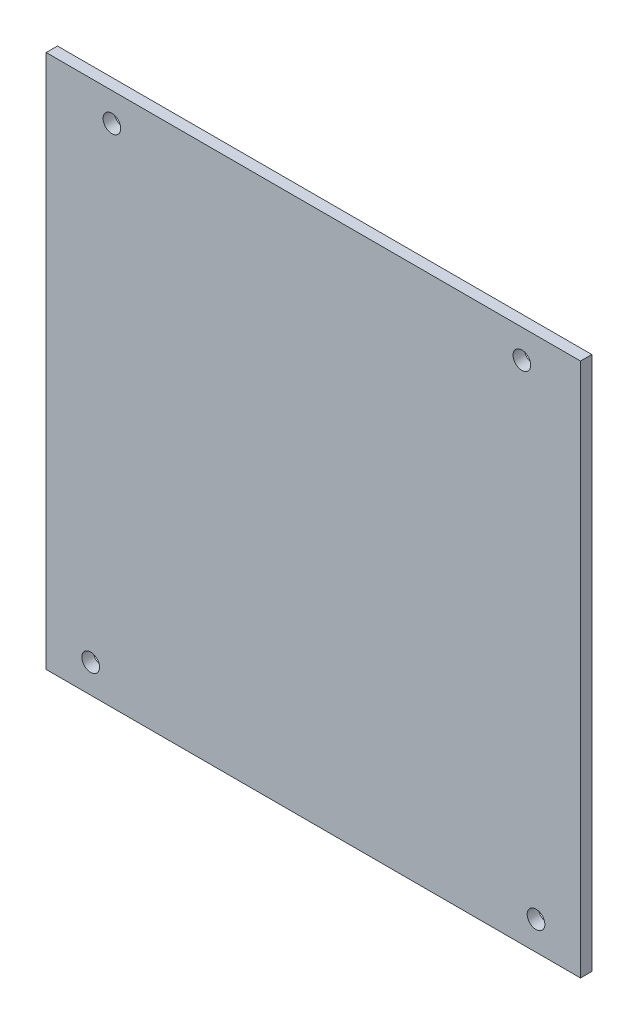
from build123d import *

# Parameters (mm, degrees)
SKETCH3_W           = 96
SKETCH3_H           = 96
SKETCH3_R           = 1.59
BOSS_EXTRUDE1_DEPTH = 1.016


with BuildPart() as part:
    # Sketch3 → Boss-Extrude1 (new, symmetric)
    with BuildSketch(Plane.XY):
        Rectangle(SKETCH3_W, SKETCH3_H)
        with Locations((40.005, -42.865)):
            Circle(SKETCH3_R, mode=Mode.SUBTRACT)
        with Locations((37.465, 42.865)):
            Circle(SKETCH3_R, mode=Mode.SUBTRACT)
        with Locations((-36.195, 42.865)):
            Circle(SKETCH3_R, mode=Mode.SUBTRACT)
        with Locations((-40.005, -42.865)):
            Circle(SKETCH3_R, mode=Mode.SUBTRACT)
    extrude(amount=BOSS_EXTRUDE1_DEPTH, both=True)


solid = part.part
